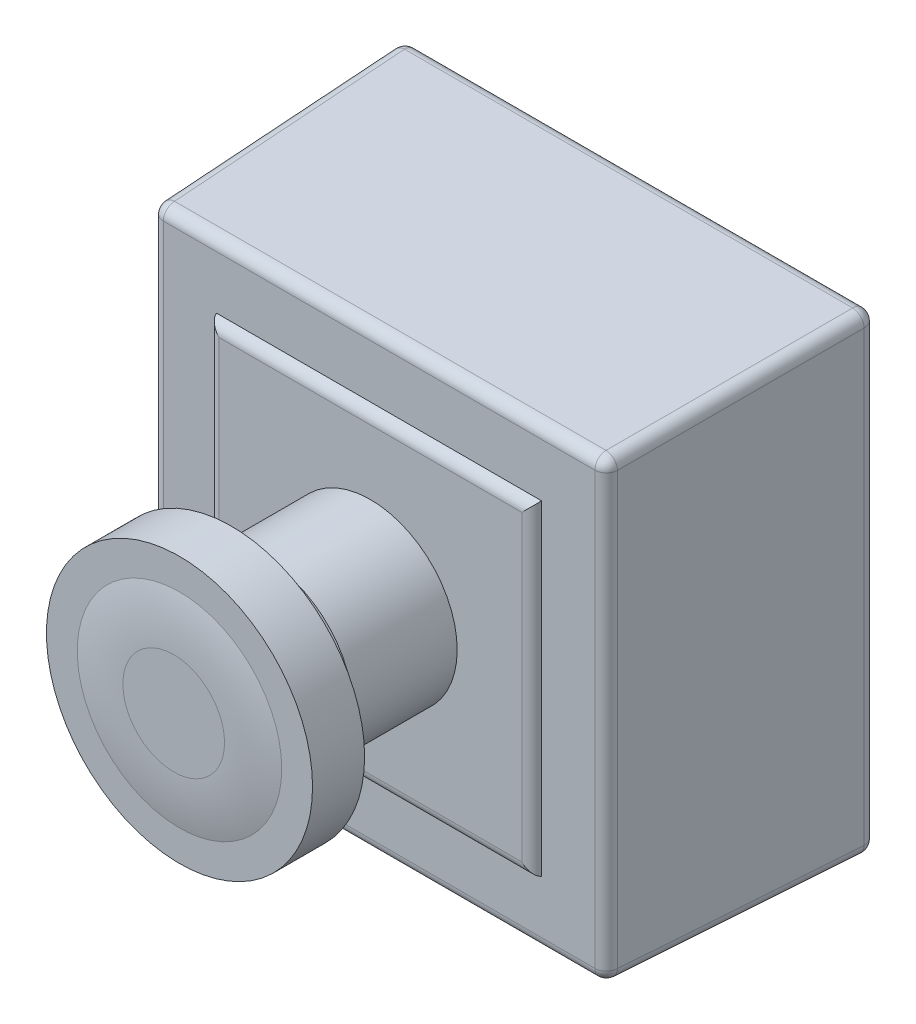
from build123d import *

# Parameters (mm, degrees)
CROQUIS1_W               = 40.8
CROQUIS1_H               = 40.8
SALIENTE_EXTRUIR1_DEPTH  = 22.6
SALIENTE_EXTRUIR1_TAPER  = 2
CROQUIS2_W               = 28.1
CROQUIS2_H               = 28.1
SALIENTE_EXTRUIR2_DEPTH  = 0.75
REDONDEO1_R              = 1
CROQUIS3_R               = 7.5
SALIENTE_EXTRUIR3_DEPTH  = 9
CROQUIS4_R               = 5.8
SALIENTE_EXTRUIR4_DEPTH  = 3
CROQUIS7_R               = 2.5
SALIENTE_EXTRUIR7_DEPTH  = 5
REDONDEO5_R              = 1
CROQUIS16_R              = 11.5
SALIENTE_EXTRUIR12_DEPTH = 4.5
CROQUIS17_R              = 8.836056804
SALIENTE_EXTRUIR13_DEPTH = 0.5
REDONDEO9_R              = 20


with BuildPart() as part:
    # Croquis1 → Saliente-Extruir1 (new body)
    with BuildSketch(Plane.XY):
        Rectangle(CROQUIS1_W, CROQUIS1_H)
    extrude(amount=SALIENTE_EXTRUIR1_DEPTH, taper=SALIENTE_EXTRUIR1_TAPER)

    # Croquis2 → Saliente-Extruir2 (add, symmetric)
    with BuildSketch(Plane.XY.offset(22.6)):
        Rectangle(CROQUIS2_W, CROQUIS2_H)
    extrude(amount=SALIENTE_EXTRUIR2_DEPTH, both=True)

    # Redondeo1
    # the kernel refuses this fillet: 1 mm, written as the material it takes off along each edge
    with BuildSketch(Plane(origin=(14.05, 16.470614591, 23.35), x_dir=(0, 0, -1), z_dir=(0, -1, 0)), Plane(origin=(-16.470614591, 14.05, 23.35), x_dir=(0, 0, -1), z_dir=(1, 0, 0)), Plane(origin=(16.470614591, -14.05, 23.35), x_dir=(0, 0, -1), z_dir=(-1, 0, 0)), Plane(origin=(-14.05, -16.470614591, 23.35), x_dir=(0, 0, -1), z_dir=(0, 1, 0))) as redondeo1_piece_1:
        with BuildLine():
            CenterArc((1, -0.968245837), REDONDEO1_R, 104.477512186, 75.522487814)
            Line((0, -0.968245837), (-0.02, -0.968245837))
            Line((-0.02, -0.968245837), (-0.02, 0))
            Line((-0.02, 0), (0, 0.02))
            ThreePointArc((0, 0.02), (0.375, 0.02), (0.745, 0.019364917))
            Line((0.745, 0.019364917), (0.75, 0))
        make_face()
    extrude(amount=32.941229183, mode=Mode.SUBTRACT)

    # Croquis3 → Saliente-Extruir3 (add)
    with BuildSketch(Plane.XY.offset(23.35)):
        Circle(CROQUIS3_R)
    extrude(amount=SALIENTE_EXTRUIR3_DEPTH)

    # Croquis4 → Saliente-Extruir4 (add)
    with BuildSketch(Plane.XY.offset(32.35)):
        Circle(CROQUIS4_R)
    extrude(amount=SALIENTE_EXTRUIR4_DEPTH)

    # Croquis7 → Saliente-Extruir7 (add)
    with BuildSketch(Plane(origin=(0, 0, 0), x_dir=(-1, 0, 0), z_dir=(0, 0, -1))):
        with Locations(Location((-9.4, 11.9, 0), (0, 0, 180))):
            Circle(CROQUIS7_R)
    extrude(amount=SALIENTE_EXTRUIR7_DEPTH)

    # Redondeo5
    redondeo5_edges = [part.edges().sort_by_distance(p)[0] for p in [
        (-19.610790609, 0, 22.6),
        (0, -19.610790609, 22.6),
        (19.610790609, 0, 22.6),
        (0, -20.4, 0),
        (-20.4, 0, 0),
        (0, 20.4, 0),
        (20.4, 0, 0),
        (20.005395305, -20.005395305, 11.3),
        (-20.005394843, -20.005394843, 11.300013228),
        (-20.005395305, 20.005395305, 11.3),
        (20.005394843, 20.005394843, 11.300013228),
        (0, 19.610790609, 22.6),
    ]]
    fillet(redondeo5_edges, radius=REDONDEO5_R)

    # Croquis16 → Saliente-Extruir12 (add)
    with BuildSketch(Plane.XY.offset(35.35)):
        Circle(CROQUIS16_R)
    extrude(amount=SALIENTE_EXTRUIR12_DEPTH)

    # Croquis17 → Saliente-Extruir13 (add)
    with BuildSketch(Plane.XY.offset(39.85)):
        Circle(CROQUIS17_R)
    extrude(amount=SALIENTE_EXTRUIR13_DEPTH)

    # Redondeo9
    # the kernel refuses this fillet: 20 mm, written as the material it takes off along each edge
    with BuildSketch(Plane(origin=(0, 0, 40.35), x_dir=(1, 0, 0), z_dir=(0, -1, 0))) as redondeo9_piece_1:
        with BuildLine():
            CenterArc((4.391959596, -20), REDONDEO9_R, 77.161431859, 12.838568141)
            Line((4.391959596, 0), (4.391959596, 0.4))
            Line((4.391959596, 0.4), (8.836056804, 0.4))
            Line((8.836056804, 0.4), (9.236056804, 0))
            ThreePointArc((9.236056804, 0), (9.236056804, -0.25), (8.924938748, -0.11))
            Line((8.924938748, -0.11), (8.836056804, -0.5))
        make_face()
    revolve(axis=Axis((0, 0, 40.35), (0, 0, 1)), mode=Mode.SUBTRACT)


solid = part.part
